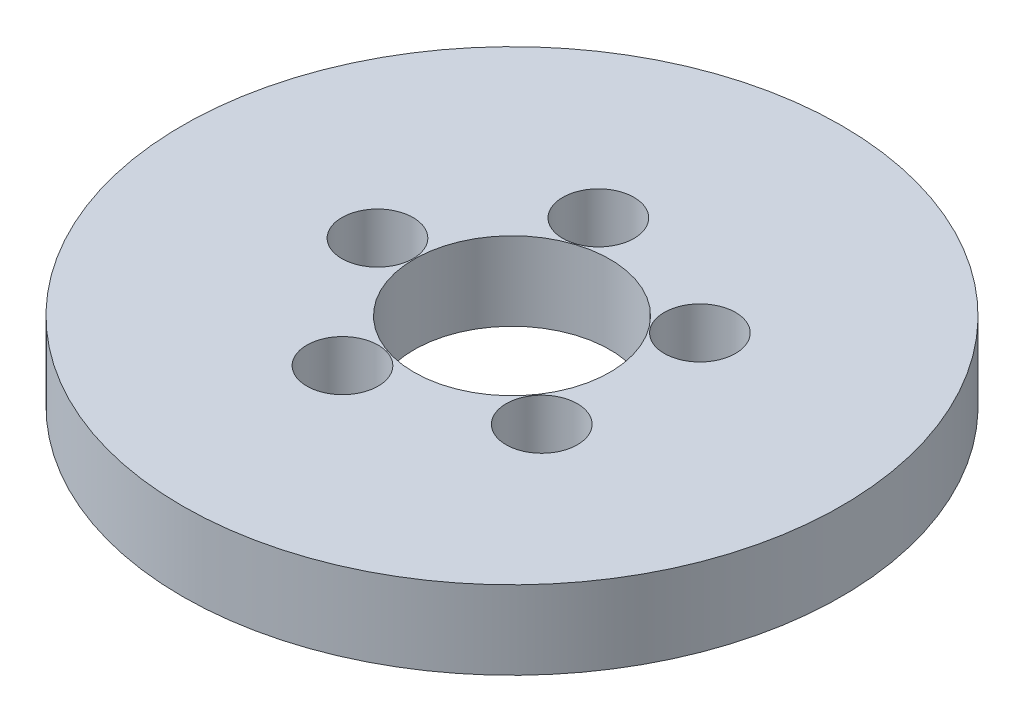
from build123d import *

# Parameters (mm, degrees)
SKETCH1_R           = 92.5
BOSS_EXTRUDE1_DEPTH = 22
SKETCH2_R           = 27.5
CUT_EXTRUDE1_DEPTH  = 133.651799837
SKETCH3_R           = 10
CUT_EXTRUDE2_DEPTH  = 16.88371012
CIRPATTERN1_COUNT   = 5


with BuildPart() as part:
    # Sketch1 → Boss-Extrude1 (new body)
    with BuildSketch(Plane(origin=(0, 0, 0), x_dir=(1, 0, 0), z_dir=(0, 1, 0))):
        Circle(SKETCH1_R)
    extrude(amount=BOSS_EXTRUDE1_DEPTH)

    # Sketch2 → Cut-Extrude1 (cut, through all)
    with BuildSketch(Plane(origin=(0, 0, 0), x_dir=(1, 0, 0), z_dir=(0, 1, 0))):
        Circle(SKETCH2_R)
    extrude(amount=CUT_EXTRUDE1_DEPTH, mode=Mode.SUBTRACT)

    # Sketch3 → Cut-Extrude2 (cut)
    with BuildSketch(Plane(origin=(0, 22, 0), x_dir=(1, 0, 0), z_dir=(0, 1, 0))):
        with Locations((-37.756047361, 0)):
            Circle(SKETCH3_R)
    cut_extrude2 = extrude(amount=-CUT_EXTRUDE2_DEPTH, mode=Mode.SUBTRACT)

    # CirPattern1: Cut-Extrude2 ×5 about axis
    cirpattern1_axis = Axis((0, 0, 0), (0, 1, 0))
    for i in range(1, CIRPATTERN1_COUNT):
        add(cut_extrude2.rotate(cirpattern1_axis, i * 360 / CIRPATTERN1_COUNT), mode=Mode.SUBTRACT)


solid = part.part
